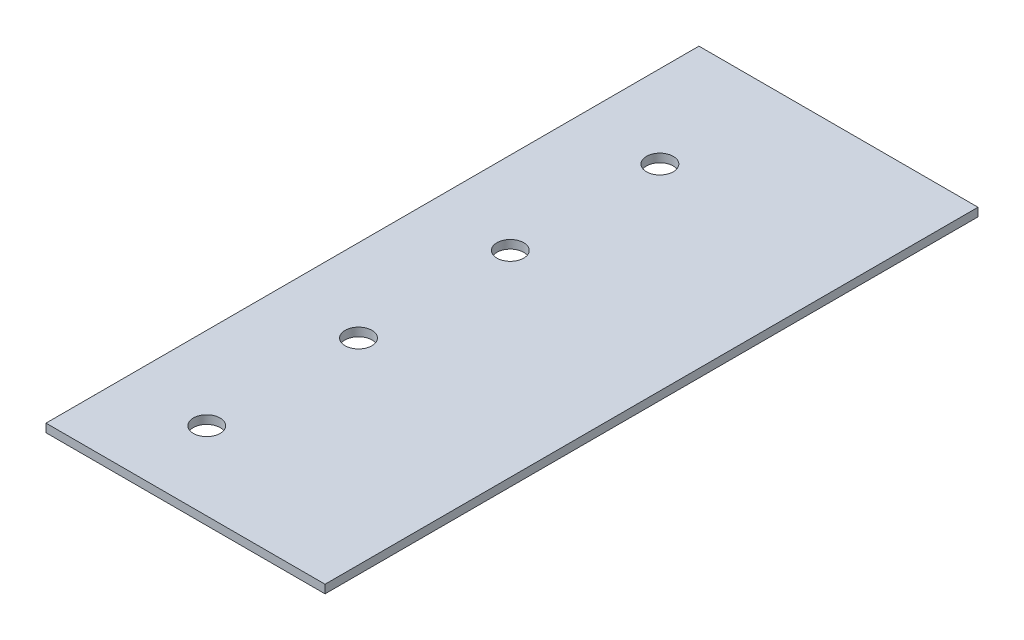
from build123d import *

# Parameters (mm, degrees)
SKETCH1_W           = 63.5
SKETCH1_H           = 148.59
BOSS_EXTRUDE1_DEPTH = 1.905
SKETCH3_R           = 3.048
CUT_EXTRUDE2_DEPTH  = 2.54


with BuildPart() as part:
    # Sketch1 → Boss-Extrude1 (new body)
    with BuildSketch(Plane(origin=(0, 0, 0), x_dir=(1, 0, 0), z_dir=(0, 1, 0))):
        with Locations((31.75, 74.295)):
            Rectangle(SKETCH1_W, SKETCH1_H)
    extrude(amount=BOSS_EXTRUDE1_DEPTH)

    # Sketch3 → Cut-Extrude2 (cut)
    with BuildSketch(Plane.XZ):
        with Locations((18.796, -86.868)):
            Circle(SKETCH3_R)
        with Locations((18.796, -52.324)):
            Circle(SKETCH3_R)
        with Locations((18.796, -17.78)):
            Circle(SKETCH3_R)
        with Locations((18.796, -120.904)):
            Circle(SKETCH3_R)
    extrude(amount=-CUT_EXTRUDE2_DEPTH, mode=Mode.SUBTRACT)


solid = part.part
